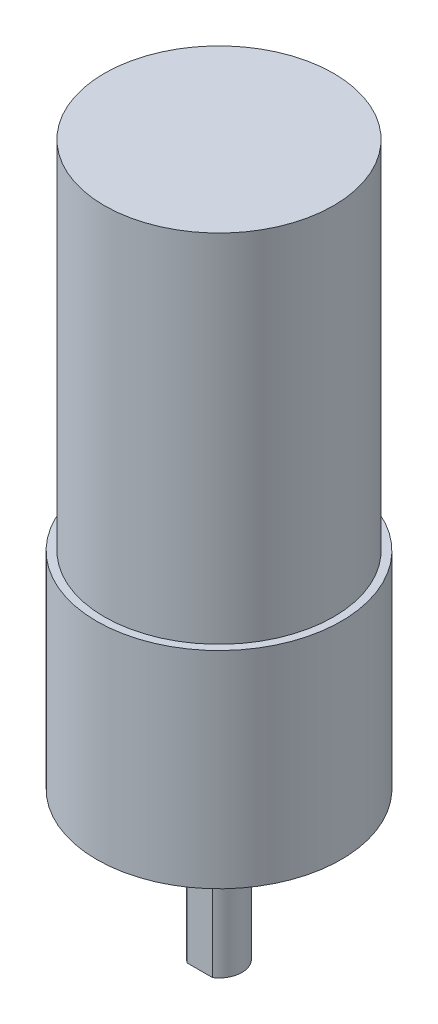
from build123d import *

# Parameters (mm, degrees)
ESQUISSE1_R             = 16
EXTRUSION1_DEPTH        = 27
EXTRUSION2_DEPTH        = 3
ESQUISSE3_R             = 3
EXTRUSION3_DEPTH        = 16.3
ENL_V_START             = -12
ENL_V_MAT_EXTRU_1_DEPTH = 12
ESQUISSE5_R             = 15
EXTRUSION4_DEPTH        = 46.6
ESQUISSE6_R             = 1.5
ENL_V_MAT_EXTRU_2_DEPTH = 5.5


with BuildPart() as part:
    # Esquisse1 → Extrusion1 (new body)
    with BuildSketch(Plane(origin=(0, 0, 0), x_dir=(1, 0, 0), z_dir=(0, 1, 0))):
        Circle(ESQUISSE1_R)
    extrude(amount=EXTRUSION1_DEPTH)

    # Esquisse2 → Extrusion2 (add)
    with BuildSketch(Plane.XZ):
        with BuildLine():
            Line((-9, 4.358898944), (-9, -4.358898944))
            ThreePointArc((-9, -4.358898944), (0, -10), (9, -4.358898944))
            Line((9, -4.358898944), (9, 4.358898944))
            ThreePointArc((9, 4.358898944), (0, 10), (-9, 4.358898944))
        make_face()
    extrude(amount=EXTRUSION2_DEPTH)

    # Esquisse3 → Extrusion3 (add)
    with BuildSketch(Plane.XZ.offset(3)):
        Circle(ESQUISSE3_R)
    extrude(amount=EXTRUSION3_DEPTH)

    # Esquisse4 → Enlèv. mat.-Extru.1 (cut)
    with BuildSketch(Plane.XZ.offset(19.3).offset(ENL_V_START)):
        with BuildLine():
            ThreePointArc((1.658312395, 2.5), (0, 3), (-1.658312395, 2.5))
            Line((-1.658312395, 2.5), (1.658312395, 2.5))
        make_face()
    extrude(amount=ENL_V_MAT_EXTRU_1_DEPTH, mode=Mode.SUBTRACT)

    # Esquisse5 → Extrusion4 (add)
    with BuildSketch(Plane(origin=(0, 27, 0), x_dir=(-1, 0, 0), z_dir=(0, 1, 0))):
        Circle(ESQUISSE5_R)
    extrude(amount=EXTRUSION4_DEPTH)

    # Esquisse6 → Enlèv. mat.-Extru.2 (cut)
    with BuildSketch(Plane.XZ):
        with Locations((9.192388155, 9.192388155)):
            Circle(ESQUISSE6_R)
        with Locations((-9.192388155, 9.192388155)):
            Circle(ESQUISSE6_R)
        with Locations((9.192388155, -9.192388155)):
            Circle(ESQUISSE6_R)
        with Locations((-9.192388155, -9.192388155)):
            Circle(ESQUISSE6_R)
    extrude(amount=-ENL_V_MAT_EXTRU_2_DEPTH, mode=Mode.SUBTRACT)


solid = part.part
